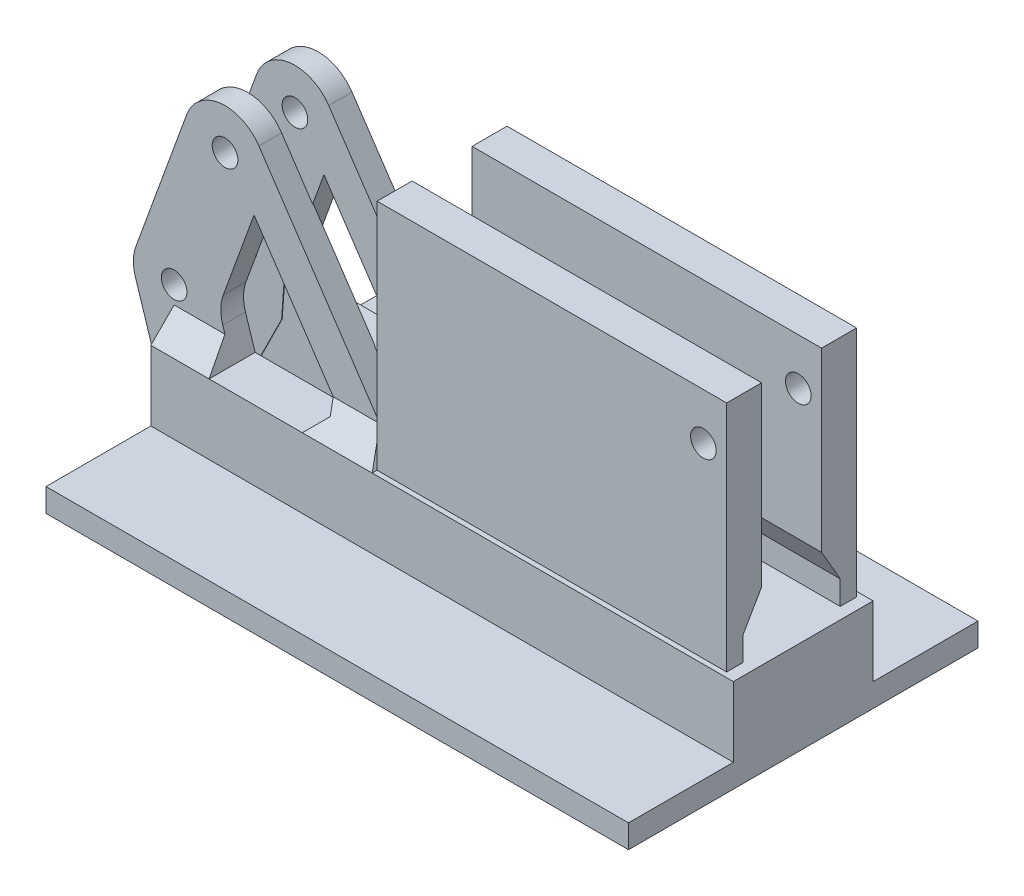
from build123d import *

# Parameters (mm, degrees)
SKETCH_1_W               = 50
SKETCH_1_H               = 30
EXTRUDE_1_DEPTH          = 4
SKETCH_2_R               = 1.1
EXTRUDE_2_DEPTH          = 4
CUT_EXTRUDE_1_DEPTH      = 2
EXTRUDE_3_DEPTH          = 2
CUT_EXTRUDE_3_DEPTH      = 2.05
SKETCH_7_W               = 30
SKETCH_7_H               = 3
EXTRUDE_4_DEPTH          = 20
FILLET_3_R               = 2
CUT_EXTRUDE_5_DEPTH      = 38.911080175
CUT_EXTRUDE_5_DEPTH_BACK = 6
SKETCH_9_W               = 10
SKETCH_9_H               = 2
CUT_EXTRUDE_6_DEPTH      = 30
CUT_EXTRUDE_7_DEPTH      = 41.165283517
CUT_EXTRUDE_7_DEPTH_BACK = 41.165283517
SKETCH_11_R              = 1.1


with BuildPart() as part:
    # 草图1 → 凸台-拉伸1 (new, symmetric)
    with BuildSketch(Plane(origin=(0, 0, 0), x_dir=(1, 0, 0), z_dir=(0, 1, 0))):
        Rectangle(SKETCH_1_W, SKETCH_1_H)
    extrude(amount=EXTRUDE_1_DEPTH, both=True)

    # 草图2 → 凸台-拉伸2 (add, symmetric)
    with BuildSketch(Plane.XY):
        with BuildLine():
            Line((-25, -4), (-28.333963394, 6.434782609))
            ThreePointArc((-28.333963394, 6.434782609), (-28.499306582, 7.56966666), (-28.288924173, 8.697070502))
            Line((-28.288924173, 8.697070502), (-23.921281362, 20.697070502))
            ThreePointArc((-23.921281362, 20.697070502), (-19.435286687, 22.788924173), (-17.343433016, 18.302929498))
            Line((-17.343433016, 18.302929498), (-20.782808769, 8.853322281))
            ThreePointArc((-20.782808769, 8.853322281), (-20.993191178, 7.72591844), (-20.827847989, 6.591034388))
            Line((-20.827847989, 6.591034388), (-20, 4))
            Line((-20, 4), (-25, -4))
        make_face()
        with Locations((-25, 7.5)):
            Circle(SKETCH_2_R, mode=Mode.SUBTRACT)
        with Locations((-20.632357189, 19.5)):
            Circle(SKETCH_2_R, mode=Mode.SUBTRACT)
    extrude(amount=EXTRUDE_2_DEPTH, both=True)

    # 草图3 → 切除-拉伸1 (cut, symmetric)
    with BuildSketch(Plane.XY):
        with BuildLine():
            ThreePointArc((-28.288924173, 8.697070502), (-28.499306582, 7.56966666), (-28.333963394, 6.434782609))
            Line((-28.333963394, 6.434782609), (-25, -4))
            Line((-25, -4), (-21.711075827, 6.302929498))
            Line((-21.711075827, 6.302929498), (-20.537616571, 5.928335213))
            Line((-20.537616571, 5.928335213), (-20.782808769, 8.853322281))
            Line((-20.782808769, 8.853322281), (-17.343433016, 18.302929498))
            ThreePointArc((-17.343433016, 18.302929498), (-19.435286687, 22.788924173), (-23.921281362, 20.697070502))
            Line((-23.921281362, 20.697070502), (-28.288924173, 8.697070502))
        make_face()
    extrude(amount=CUT_EXTRUDE_1_DEPTH, both=True, mode=Mode.SUBTRACT)

    # 草图4 → 凸台-拉伸3 (add)
    with BuildSketch(Plane.XY.offset(4)):
        Polygon((-17.727312988, 21.45210609), (-6, 4), (-10, 4), (-18.140180759, 16.113883065), align=None)
    extrude_3 = extrude(amount=-EXTRUDE_3_DEPTH)

    # 镜向1: 凸台-拉伸3 across plane
    add(extrude_3.mirror(Plane.XY))

    # 草图6 → 切除-拉伸3 (cut, symmetric)
    with BuildSketch(Plane.XY):
        with BuildLine():
            Line((-21.508926635, 7.250186543), (-22.273988478, -3.441339253))
            ThreePointArc((-22.273988478, -3.441339253), (-12.102598016, -1.859850385), (-3.639711721, 4))
            Line((-3.639711721, 4), (-11.558922773, 11.223582198))
            ThreePointArc((-11.558922773, 11.223582198), (-16.077786178, 8.094642196), (-21.508926635, 7.250186543))
        make_face()
        with BuildLine():
            Line((-22.273988478, -3.441339253), (-21.774361564, 3.540807476))
            Line((-21.774361564, 3.540807476), (-25.057597959, -3.070273462))
            ThreePointArc((-25.057597959, -3.070273462), (-23.671461761, -3.298329838), (-22.273988478, -3.441339253))
        make_face()
    extrude(amount=CUT_EXTRUDE_3_DEPTH, both=True, mode=Mode.SUBTRACT)

    # 草图7 → 凸台-拉伸4 (add)
    with BuildSketch(Plane(origin=(0, 4, 0), x_dir=(1, 0, 0), z_dir=(0, 1, 0))):
        with Locations((9, -4.075)):
            Rectangle(SKETCH_7_W, SKETCH_7_H)
        with Locations((9, 4.075)):
            Rectangle(SKETCH_7_W, SKETCH_7_H)
    extrude(amount=EXTRUDE_4_DEPTH)

    # 圆角3
    # the kernel refuses this fillet: 2 mm, written as the material it takes off along each edge
    with BuildSketch(Plane(origin=(-21.579710991, 6.260994922, 2), x_dir=(-0.07137527342969462, -0.9974495327297699, 0), z_dir=(0, 0, -1))) as fillet_3_piece_1:
        with BuildLine():
            CenterArc((0.687360644, 2), FILLET_3_R, 248.905574678, 21.094425322)
            Line((-0.032451423, 0.134022886), (-0.046847664, 0.096703344))
            ThreePointArc((-0.046847664, 0.096703344), (-0.055102303, 0.05759812), (-0.038876591, -0.009413323))
            Line((-0.038876591, -0.009413323), (0, -0.04))
            Line((0, -0.04), (0.687360644, -0.04))
            Line((0.687360644, -0.04), (0.687360644, 0))
        make_face()
    extrude(amount=4, mode=Mode.SUBTRACT)

    # 倒角2
    # the kernel refuses this chamfer: 2, 1.441174265 mm, written as the material it adds along each edge
    with BuildSketch(Plane(origin=(-6, 4, -4), x_dir=(0, -0.02749587661058627, -0.9996219169112968), z_dir=(-1, 0, 0))) as chamfer_2_piece_1_section:
        with BuildLine():
            Line((2.05734639, 0), (-0.11309431, -2.054235587))
            Line((-0.11309431, -2.054235587), (-0.153079186, -2.053135752))
            ThreePointArc((-0.153079186, -2.053135752), (-0.068258454, -1.026795659), (-0.039984877, 0.001099835))
            Line((-0.039984877, 0.001099835), (0.001099835, 0.039984877))
            ThreePointArc((0.001099835, 0.039984877), (1.028995329, 0.011711299), (2.058446225, 0.039984877))
            Line((2.058446225, 0.039984877), (2.05734639, 0))
        make_face()
    chamfer_2_piece_1 = extrude(amount=9.143365976, mode=Mode.PRIVATE)
    chamfer_2_piece_1 = split(chamfer_2_piece_1, bisect_by=Plane(origin=(-7.065617909, 5.585808856, -4.659423843), z_dir=(-0.8300126289410857, -0.5577445972829389, 0)), keep=Keep.TOP, mode=Mode.PRIVATE)
    chamfer_2_piece_1 = split(chamfer_2_piece_1, bisect_by=Plane(origin=(-9.821301765, 3.734068618, -4.659423843), z_dir=(0.8300126289410859, 0.5577445972829388, 0)), keep=Keep.TOP, mode=Mode.PRIVATE)
    add(chamfer_2_piece_1)
    with BuildSketch(Plane(origin=(-25, 4, 4), x_dir=(0, -0.02749587661058627, 0.9996219169112968), z_dir=(1, 0, 0))) as chamfer_2_piece_2_section:
        with BuildLine():
            Line((2.05734639, 0), (-0.11309431, -2.054235587))
            Line((-0.11309431, -2.054235587), (-0.153079186, -2.053135752))
            ThreePointArc((-0.153079186, -2.053135752), (-0.068258454, -1.026795659), (-0.039984877, 0.001099835))
            Line((-0.039984877, 0.001099835), (0.001099835, 0.039984877))
            ThreePointArc((0.001099835, 0.039984877), (1.028995329, 0.011711299), (2.058446225, 0.039984877))
            Line((2.058446225, 0.039984877), (2.05734639, 0))
        make_face()
    chamfer_2_piece_2 = extrude(amount=10.143365976, mode=Mode.PRIVATE)
    chamfer_2_piece_2 = split(chamfer_2_piece_2, bisect_by=Plane(origin=(-20.42738659, 5.337653005, 4.668646513), z_dir=(-0.9525609695742022, -0.30434782608695565, 0)), keep=Keep.TOP, mode=Mode.PRIVATE)
    add(chamfer_2_piece_2)
    with BuildSketch(Plane(origin=(-25, 4, -4), x_dir=(0, -0.02749587661058627, -0.9996219169112968), z_dir=(1, 0, 0))) as chamfer_2_piece_3_section:
        with BuildLine():
            Line((2.05734639, 0), (-0.11309431, 2.054235587))
            Line((-0.11309431, 2.054235587), (-0.153079186, 2.053135752))
            ThreePointArc((-0.153079186, 2.053135752), (-0.068258454, 1.026795659), (-0.039984877, -0.001099835))
            Line((-0.039984877, -0.001099835), (0.001099835, -0.039984877))
            ThreePointArc((0.001099835, -0.039984877), (1.028995329, -0.011711299), (2.058446225, -0.039984877))
            Line((2.058446225, -0.039984877), (2.05734639, 0))
        make_face()
    chamfer_2_piece_3 = extrude(amount=10.143365976, mode=Mode.PRIVATE)
    chamfer_2_piece_3 = split(chamfer_2_piece_3, bisect_by=Plane(origin=(-20.42738659, 5.337653005, -4.668646513), z_dir=(-0.9525609695742022, -0.30434782608695565, 0)), keep=Keep.TOP, mode=Mode.PRIVATE)
    add(chamfer_2_piece_3)
    with BuildSketch(Plane(origin=(-6, 4, 4), x_dir=(0, -0.02749587661058627, 0.9996219169112968), z_dir=(-1, 0, 0))) as chamfer_2_piece_4_section:
        with BuildLine():
            Line((2.05734639, 0), (-0.11309431, 2.054235587))
            Line((-0.11309431, 2.054235587), (-0.153079186, 2.053135752))
            ThreePointArc((-0.153079186, 2.053135752), (-0.068258454, 1.026795659), (-0.039984877, -0.001099835))
            Line((-0.039984877, -0.001099835), (0.001099835, -0.039984877))
            ThreePointArc((0.001099835, -0.039984877), (1.028995329, -0.011711299), (2.058446225, -0.039984877))
            Line((2.058446225, -0.039984877), (2.05734639, 0))
        make_face()
    chamfer_2_piece_4 = extrude(amount=9.143365976, mode=Mode.PRIVATE)
    chamfer_2_piece_4 = split(chamfer_2_piece_4, bisect_by=Plane(origin=(-9.821301765, 3.734068618, 4.659423843), z_dir=(0.8300126289410859, 0.5577445972829388, 0)), keep=Keep.TOP, mode=Mode.PRIVATE)
    chamfer_2_piece_4 = split(chamfer_2_piece_4, bisect_by=Plane(origin=(-7.065617909, 5.585808856, 4.659423843), z_dir=(-0.8300126289410857, -0.5577445972829389, 0)), keep=Keep.TOP, mode=Mode.PRIVATE)
    add(chamfer_2_piece_4)
    with BuildSketch(Plane(origin=(-10, 4, -4), x_dir=(-0.9985507752193709, -0.0538177415802029, 0), z_dir=(0, 0, 1))) as chamfer_2_piece_5:
        with BuildLine():
            Line((1.45869004, 0), (1.004929429, -1.795213361))
            Line((1.004929429, -1.795213361), (0.970576376, -1.815704037))
            ThreePointArc((0.970576376, -1.815704037), (0.492402938, -0.903608261), (-0.034353052, -0.020490676))
            Line((-0.034353052, -0.020490676), (0.00215271, 0.039942031))
            ThreePointArc((0.00215271, 0.039942031), (0.729385292, 0.000747214), (1.46084275, 0.039942031))
            Line((1.46084275, 0.039942031), (1.45869004, 0))
        make_face()
    extrude(amount=1.95)
    with BuildSketch(Plane(origin=(-10, 4, 4), x_dir=(-0.9996219169112968, -0.027495876610585623, 0), z_dir=(0, 0, -1))) as chamfer_2_piece_6:
        with BuildLine():
            Line((2.05734639, 0), (0.712510327, 1.272833716))
            Line((0.712510327, 1.272833716), (0.678708947, 1.294222188))
            ThreePointArc((0.678708947, 1.294222188), (0.355622826, 0.636816982), (-0.03380138, 0.021388472))
            Line((-0.03380138, 0.021388472), (0.001099835, -0.039984877))
            ThreePointArc((0.001099835, -0.039984877), (1.028995329, -0.011711299), (2.058446225, -0.039984877))
            Line((2.058446225, -0.039984877), (2.05734639, 0))
        make_face()
    extrude(amount=1.95)
    with BuildSketch(Plane(origin=(-10, 4, -9.143365976), x_dir=(-0.9985507752193707, -0.053817741580204116, 0), z_dir=(0, 0, 1))) as chamfer_2_piece_7a_section:
        with BuildLine():
            Line((1.45869004, 0), (1.004929429, -1.795213361))
            Line((1.004929429, -1.795213361), (0.970576376, -1.815704037))
            ThreePointArc((0.970576376, -1.815704037), (0.492402938, -0.903608261), (-0.034353052, -0.020490676))
            Line((-0.034353052, -0.020490676), (0.00215271, 0.039942031))
            ThreePointArc((0.00215271, 0.039942031), (0.729385292, 0.000747214), (1.46084275, 0.039942031))
            Line((1.46084275, 0.039942031), (1.45869004, 0))
        make_face()
    chamfer_2_piece_7a = extrude(amount=7.093365976, mode=Mode.PRIVATE)
    chamfer_2_piece_7a = split(chamfer_2_piece_7a, bisect_by=Plane(origin=(-10.840073323, 4.554425115, -4), z_dir=(0, 0, -1)), keep=Keep.TOP, mode=Mode.PRIVATE)
    with BuildSketch(Plane(origin=(-6, 4, -4), x_dir=(0, -0.02749587661058627, -0.9996219169112968), z_dir=(-1, 0, 0))) as chamfer_2_piece_7b_section:
        with BuildLine():
            Line((2.05734639, 0), (-0.11309431, -2.054235587))
            Line((-0.11309431, -2.054235587), (-0.153079186, -2.053135752))
            ThreePointArc((-0.153079186, -2.053135752), (-0.068258454, -1.026795659), (-0.039984877, 0.001099835))
            Line((-0.039984877, 0.001099835), (0.001099835, 0.039984877))
            ThreePointArc((0.001099835, 0.039984877), (1.028995329, 0.011711299), (2.058446225, 0.039984877))
            Line((2.058446225, 0.039984877), (2.05734639, 0))
        make_face()
    chamfer_2_piece_7b = extrude(amount=9.143365976, mode=Mode.PRIVATE)
    chamfer_2_piece_7b = split(chamfer_2_piece_7b, bisect_by=Plane(origin=(-11.153674237, 5.716850671, -4.67900162), z_dir=(-0.8300126289410859, -0.5577445972829388, 0)), keep=Keep.TOP, mode=Mode.PRIVATE)
    chamfer_2_piece_7 = chamfer_2_piece_7a & chamfer_2_piece_7b
    add(chamfer_2_piece_7)
    with BuildSketch(Plane(origin=(-6, 4, 4), x_dir=(0, -0.02749587661058627, 0.9996219169112968), z_dir=(-1, 0, 0))) as chamfer_2_piece_8a_section:
        with BuildLine():
            Line((2.05734639, 0), (-0.11309431, 2.054235587))
            Line((-0.11309431, 2.054235587), (-0.153079186, 2.053135752))
            ThreePointArc((-0.153079186, 2.053135752), (-0.068258454, 1.026795659), (-0.039984877, -0.001099835))
            Line((-0.039984877, -0.001099835), (0.001099835, -0.039984877))
            ThreePointArc((0.001099835, -0.039984877), (1.028995329, -0.011711299), (2.058446225, -0.039984877))
            Line((2.058446225, -0.039984877), (2.05734639, 0))
        make_face()
    chamfer_2_piece_8a = extrude(amount=9.143365976, mode=Mode.PRIVATE)
    chamfer_2_piece_8a = split(chamfer_2_piece_8a, bisect_by=Plane(origin=(-11.153674237, 5.716850671, 4.67900162), z_dir=(-0.8300126289410859, -0.5577445972829388, 0)), keep=Keep.TOP, mode=Mode.PRIVATE)
    with BuildSketch(Plane(origin=(-10, 4, 9.143365976), x_dir=(-0.9996219169112968, -0.027495876610586487, 0), z_dir=(0, 0, -1))) as chamfer_2_piece_8b_section:
        with BuildLine():
            Line((2.05734639, 0), (0.712510327, 1.272833716))
            Line((0.712510327, 1.272833716), (0.678708947, 1.294222188))
            ThreePointArc((0.678708947, 1.294222188), (0.355622826, 0.636816982), (-0.03380138, 0.021388472))
            Line((-0.03380138, 0.021388472), (0.001099835, -0.039984877))
            ThreePointArc((0.001099835, -0.039984877), (1.028995329, -0.011711299), (2.058446225, -0.039984877))
            Line((2.058446225, -0.039984877), (2.05734639, 0))
        make_face()
    chamfer_2_piece_8b = extrude(amount=7.093365976, mode=Mode.PRIVATE)
    chamfer_2_piece_8b = split(chamfer_2_piece_8b, bisect_by=Plane(origin=(-10.928726204, 4.388043855, 4), z_dir=(0, 0, 1)), keep=Keep.TOP, mode=Mode.PRIVATE)
    chamfer_2_piece_8 = chamfer_2_piece_8a & chamfer_2_piece_8b
    add(chamfer_2_piece_8)

    # 草图9 → 切除-拉伸5 (cut, two sides: drawn at the far end of the back side and taken through both)
    with BuildSketch(Plane(origin=(0, 4, 0), x_dir=(1, 0, 0), z_dir=(0, 1, 0)).offset(-CUT_EXTRUDE_5_DEPTH_BACK)):
        Polygon((-15.057597959, -2.05), (-15.057597959, 0), (-25.057597959, 0), (-25.057597959, -2.05), (-20, -2.05), align=None)
        with Locations((-20.057597959, 1)):
            Rectangle(SKETCH_9_W, SKETCH_9_H)
        Polygon((25, 15), (-25, 15), (-25, 6), (-20, 6), (-11.441174265, 6), (-6, 6), (25, 6), align=None)
        Polygon((25, -15), (25, -6), (-6, -6), (-12, -6), (-20, -6), (-25, -6), (-25, -15), align=None)
    extrude(amount=CUT_EXTRUDE_5_DEPTH + CUT_EXTRUDE_5_DEPTH_BACK, mode=Mode.SUBTRACT)

    # 草图10 → 切除-拉伸6 (cut)
    with BuildSketch(Plane(origin=(24, 0, 0), x_dir=(0, 0, -1), z_dir=(1, 0, 0))):
        Polygon((-2.575, 4), (-4.175, 4), (-4.175, 6.05), (-2.575, 8.821281292), align=None)
        Polygon((4.175, 6.05), (2.575, 8.821281292), (2.575, 4), (4.175, 4), align=None)
    extrude(amount=-CUT_EXTRUDE_6_DEPTH, mode=Mode.SUBTRACT)

    # 草图11 → 切除-拉伸7 (cut, two sides: drawn at the far end of the back side and taken through both)
    with BuildSketch(Plane.XY.offset(-CUT_EXTRUDE_7_DEPTH_BACK)):
        with Locations((22, 20)):
            Circle(SKETCH_11_R)
    extrude(amount=CUT_EXTRUDE_7_DEPTH + CUT_EXTRUDE_7_DEPTH_BACK, mode=Mode.SUBTRACT)


solid = part.part
